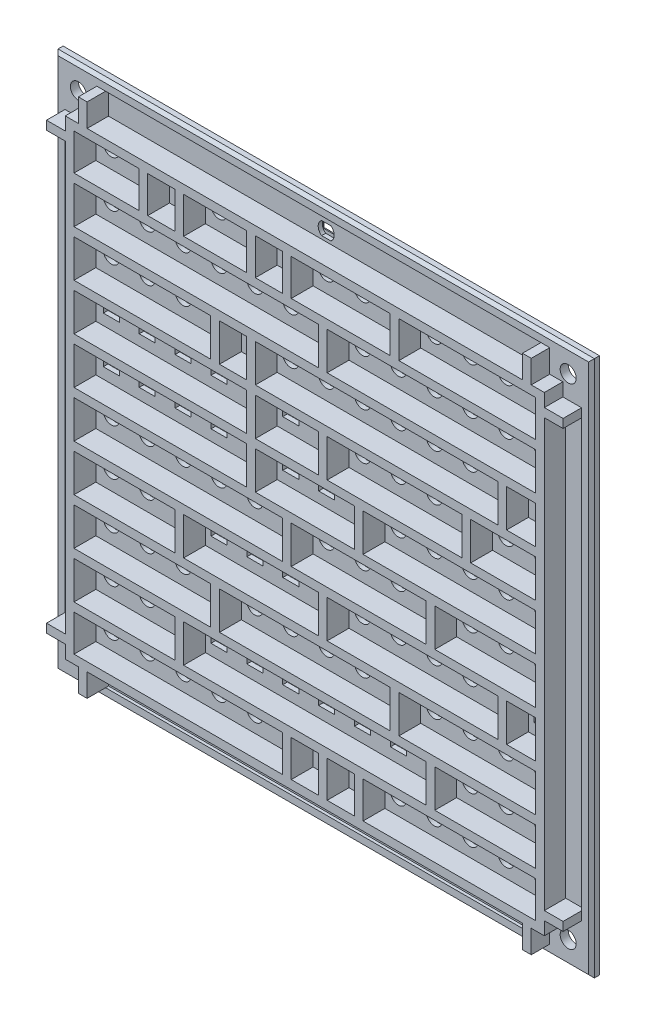
from build123d import *

# Parameters (mm, degrees)
SKETCH1_W                                    = 184.15
SKETCH1_H                                    = 184.15
PANEL_DEPTH                                  = 2.75
LED_HOLE_REACH                               = 132.243
SKETCH19_R                                   = 2.75
LED_HOLES_PATTERN_COUNT                      = 13
LED_HOLES_PATTERN_PITCH                      = 12.319
LED_HOLES_PATTERN_COUNT_DIR2                 = 10
LED_HOLES_PATTERN_PITCH_DIR2                 = 15.94
SKETCH2_R                                    = 2.75
SKETCH2_W                                    = 4.99243385
SKETCH2_H                                    = 2.307727076
CORNER_LEDS_LIGHT_SENSOR_CUT_DEPTH           = 131.242749318
LIGHT_SENSOR_HOLDER_DEPTH                    = 2.4
SKETCH6_W                                    = 164.47360298
SKETCH6_H                                    = 161.542860252
OUTER_LIGHT_WALLS_DEPTH                      = 6.35
SKETCH7_W                                    = 158.47360298
SKETCH7_H                                    = 155.542860252
OUTER_LIGHT_WALLS_CUT_DEPTH                  = 7.5
SKETCH8_W                                    = 158.47560298
SKETCH8_H                                    = 3
INNER_H_WALLS_DEPTH                          = 7.5
INNER_H_WALLS_PATTERN_COUNT                  = 9
INNER_H_WALLS_PATTERN_PITCH                  = 15.94
INNER_START                                  = -1.15
INNER_V_WALLS_1ST_LINE_DEPTH                 = 7.5
INNER_V_WALLS_PATTERN_1ST_LINE_COUNT         = 12
INNER_V_WALLS_PATTERN_1ST_LINE_PITCH         = 12.32
SKETCH13_W                                   = 3
SKETCH13_H                                   = 12.501430126
EXTRA_V_WALLS_REMOVAL_1ST_LINE_DEPTH         = 7.5
SKETCH14_W                                   = 3
SKETCH14_H                                   = 12.94
INNER_V_WALLS_DEPTH                          = 7.5
INNER_V_WALLS_PATTERN_COUNT                  = 12
INNER_V_WALLS_PATTERN_PITCH                  = 12.32
INNER_V_WALLS_PATTERN_COUNT_DIR2             = 9
INNER_V_WALLS_PATTERN_PITCH_DIR2             = 15.94
SKETCH15_W                                   = 3
SKETCH15_H                                   = 12.94
EXTRA_V_WALLS_REMOVAL_DEPTH                  = 7.5
SKETCH16_W                                   = 6.43819851
SKETCH16_H                                   = 3
SKETCH16_W_2                                 = 3
SKETCH16_H_2                                 = 7.903569874
CORNER_LED_LIGHT_BAFFLES_DEPTH               = 6.35
CORNER_LED_LIGHT_BAFFLES_MIRROR_2_COPY_1_W   = 6.43819851
CORNER_LED_LIGHT_BAFFLES_MIRROR_2_COPY_1_H   = 3
CORNER_LED_LIGHT_BAFFLES_MIRROR_2_COPY_1_W_2 = 3
CORNER_LED_LIGHT_BAFFLES_MIRROR_2_COPY_1_H_2 = 7.903569874
CORNER_LED_LIGHT_BAFFLES_MIRROR_2_CO_2_DEPTH = 6.35
LED_STRIP_SQUARE_HOLE_1ST_LINE_REACH         = 132.43
SKETCH20_W                                   = 5.5
SKETCH20_H                                   = 5.5
LED_STRIP_SQUARE_HOLE_REACH                  = 132.43
SKETCH22_W                                   = 5.5
SKETCH22_H                                   = 5.5
LED_STRIP_SQUARE_HOLES_PATTERN_COUNT         = 13
LED_STRIP_SQUARE_HOLES_PATTERN_PITCH         = 12.319
LED_STRIP_SQUARE_HOLES_PATTERN_COUNT_DIR2    = 6
LED_STRIP_SQUARE_HOLES_PATTERN_PITCH_DIR2    = 15.94
SKETCH27_W                                   = 149.47360298
SKETCH27_H                                   = 7.903569874
SKETCH27_W_2                                 = 6.43819851
SKETCH27_H_2                                 = 146.542860252
CUT_EXTRUDE15_DEPTH                          = 1
CHAMFER1_SIZE                                = 1


with BuildPart() as part:
    # Sketch1 → panel (new body)
    with BuildSketch(Plane.XY):
        Rectangle(SKETCH1_W, SKETCH1_H)
    extrude(amount=PANEL_DEPTH)

    # Sketch19 → LED hole (cut, up to next)
    with BuildSketch(Plane.XY.offset(2.75), mode=Mode.PRIVATE) as led_hole_sk1:
        with Locations((-73.915, 71.74)):
            Circle(SKETCH19_R)
    led_hole_tool1 = extrude(led_hole_sk1.sketch, amount=-LED_HOLE_REACH, mode=Mode.PRIVATE) & part.part
    led_hole = led_hole_tool1.solids().sort_by_distance((-73.915, 71.74, 2.75))[0]
    add(led_hole, mode=Mode.SUBTRACT)

    # LED holes pattern: LED hole 13 × 10, 32 skipped
    with Locations(*[(i * LED_HOLES_PATTERN_PITCH, -j * LED_HOLES_PATTERN_PITCH_DIR2, 0) for i in range(LED_HOLES_PATTERN_COUNT) for j in range(LED_HOLES_PATTERN_COUNT_DIR2) if (i, j) not in ((0, 0), (0, 3), (0, 4), (1, 3), (1, 4), (2, 0), (2, 3), (2, 4), (3, 3), (3, 4), (3, 6), (3, 8), (4, 2), (4, 3), (4, 4), (4, 6), (4, 8), (5, 0), (5, 3), (5, 4), (5, 6), (5, 8), (6, 3), (6, 4), (6, 6), (6, 8), (6, 9), (7, 4), (7, 8), (8, 8), (9, 8), (12, 2), (12, 6))]):
        add(led_hole, mode=Mode.SUBTRACT)

    # Sketch2 → corner LEDs _ light sensor cut (cut, through all)
    with BuildSketch(Plane.XY.offset(2.75)):
        with Locations((-84.075, 84.075)):
            Circle(SKETCH2_R)
        with Locations(Location((84.075, 84.075, 0), (0, 0, 180))):
            Circle(SKETCH2_R)
        with Locations((84.075, -84.075)):
            Circle(SKETCH2_R)
        with Locations(Location((-84.075, -84.075, 0), (0, 0, 180))):
            Circle(SKETCH2_R)
        with Locations((0, 84.075)):
            Rectangle(SKETCH2_W, SKETCH2_H)
    extrude(amount=-CORNER_LEDS_LIGHT_SENSOR_CUT_DEPTH, mode=Mode.SUBTRACT)

    # Sketch3 → light sensor holder (cut)
    with BuildSketch(Plane.XY.offset(2.75)):
        with BuildLine():
            Line((-1.58113883, 81.825), (1.58113883, 81.825))
            ThreePointArc((1.58113883, 81.825), (2.75, 84.075), (1.58113883, 86.325))
            Line((1.58113883, 86.325), (-1.58113883, 86.325))
            ThreePointArc((-1.58113883, 86.325), (-2.75, 84.075), (-1.58113883, 81.825))
        make_face()
    extrude(amount=-LIGHT_SENSOR_HOLDER_DEPTH, mode=Mode.SUBTRACT)

    # Sketch6 → outer light walls (add)
    with BuildSketch(Plane.XY.offset(2.75)):
        Rectangle(SKETCH6_W, SKETCH6_H)
    extrude(amount=OUTER_LIGHT_WALLS_DEPTH)

    # Sketch7 → outer light walls cut (cut)
    with BuildSketch(Plane.XY.offset(9.1)):
        Rectangle(SKETCH7_W, SKETCH7_H)
    extrude(amount=-OUTER_LIGHT_WALLS_CUT_DEPTH, mode=Mode.SUBTRACT)

    # Sketch8 → inner H walls (add)
    with BuildSketch(Plane.XY.offset(1.6)):
        with Locations((-0.001, 63.77)):
            Rectangle(SKETCH8_W, SKETCH8_H)
    inner_h_walls = extrude(amount=INNER_H_WALLS_DEPTH)

    # inner H walls pattern: inner H walls ×9
    with Locations(*[(0, -i * INNER_H_WALLS_PATTERN_PITCH, 0) for i in range(1, INNER_H_WALLS_PATTERN_COUNT)]):
        add(inner_h_walls)

    # Sketch12 → inner V walls _1st line (add)
    with BuildSketch(Plane.XY.offset(2.75).offset(INNER_START)):
        Polygon((-69.2555, 65.708569874), (-69.2555, 65.27), (-66.2555, 65.27), (-66.2555, 65.708569874), (-66.2555, 77.771430126), (-69.2555, 77.771430126), align=None)
    inner_v_walls_1st_line = extrude(amount=INNER_V_WALLS_1ST_LINE_DEPTH)

    # inner V walls pattern _1st line: inner V walls _1st line ×12, 6 skipped
    with Locations(*[(i * INNER_V_WALLS_PATTERN_1ST_LINE_PITCH, 0, 0) for i in range(1, INNER_V_WALLS_PATTERN_1ST_LINE_COUNT) if i not in (3, 6, 7, 9, 10, 11)]):
        add(inner_v_walls_1st_line)

    # Sketch13 → extra V walls removal _1st line (cut)
    with BuildSketch(Plane.XY.offset(9.1)):
        with Locations((-67.7555, 71.520715063)):
            Rectangle(SKETCH13_W, SKETCH13_H)
    extrude(amount=-EXTRA_V_WALLS_REMOVAL_1ST_LINE_DEPTH, mode=Mode.SUBTRACT)

    # Sketch14 → inner V walls (add)
    with BuildSketch(Plane.XY.offset(2.75).offset(INNER_START)):
        with Locations((-67.7555, 55.8)):
            Rectangle(SKETCH14_W, SKETCH14_H)
    inner_v_walls = extrude(amount=INNER_V_WALLS_DEPTH)

    # inner V walls pattern: inner V walls 12 × 9, 86 skipped
    with Locations(*[(i * INNER_V_WALLS_PATTERN_PITCH, -j * INNER_V_WALLS_PATTERN_PITCH_DIR2, 0) for i in range(INNER_V_WALLS_PATTERN_COUNT) for j in range(INNER_V_WALLS_PATTERN_COUNT_DIR2) if (i, j) not in ((0, 0), (0, 1), (0, 2), (0, 3), (0, 4), (0, 5), (0, 6), (0, 7), (0, 8), (1, 0), (1, 1), (1, 2), (1, 3), (1, 4), (1, 5), (1, 6), (1, 7), (1, 8), (2, 0), (2, 1), (2, 2), (2, 3), (2, 4), (2, 6), (2, 8), (3, 0), (3, 2), (3, 3), (3, 4), (3, 5), (3, 7), (3, 8), (4, 0), (4, 4), (4, 5), (4, 6), (4, 7), (4, 8), (5, 0), (5, 1), (5, 2), (5, 3), (5, 5), (5, 6), (5, 7), (6, 1), (6, 3), (6, 4), (6, 6), (6, 7), (7, 0), (7, 1), (7, 2), (7, 4), (7, 5), (7, 6), (7, 7), (8, 0), (8, 1), (8, 2), (8, 3), (8, 4), (8, 5), (8, 7), (8, 8), (9, 0), (9, 1), (9, 2), (9, 3), (9, 5), (9, 6), (9, 8), (10, 0), (10, 1), (10, 3), (10, 4), (10, 5), (10, 6), (10, 7), (10, 8), (11, 0), (11, 2), (11, 3), (11, 4), (11, 6), (11, 7), (11, 8))]):
        add(inner_v_walls)

    # Sketch15 → extra V walls removal (cut)
    with BuildSketch(Plane.XY.offset(9.1)):
        with Locations((-67.7555, 55.8)):
            Rectangle(SKETCH15_W, SKETCH15_H)
    extrude(amount=-EXTRA_V_WALLS_REMOVAL_DEPTH, mode=Mode.SUBTRACT)

    # Sketch16 → corner LED light baffles (add)
    with BuildSketch(Plane.XY.offset(2.75)):
        with Locations((-85.455900745, 74.771430126)):
            Rectangle(SKETCH16_W, SKETCH16_H)
        with Locations((-76.23680149, 84.723215063)):
            Rectangle(SKETCH16_W_2, SKETCH16_H_2)
    corner_led_light_baffles = extrude(amount=CORNER_LED_LIGHT_BAFFLES_DEPTH)

    # corner LED light baffles mirror: corner LED light baffles across plane
    add(corner_led_light_baffles.mirror(Plane(origin=(0, 0, 0), x_dir=(0, 0, 1), z_dir=(1, 0, 0))))

    # corner LED light baffles mirror 2: corner LED light baffles across plane
    add(corner_led_light_baffles.mirror(Plane.ZX))

    # corner LED light baffles mirror 2 copy 1 → corner LED light baffles mirror 2 co 2 (add)
    with BuildSketch(Plane(origin=(0, 0, 2.75), x_dir=(-1, 0, 0), z_dir=(0, 0, 1))):
        with Locations((-85.455900745, 74.771430126)):
            Rectangle(CORNER_LED_LIGHT_BAFFLES_MIRROR_2_COPY_1_W, CORNER_LED_LIGHT_BAFFLES_MIRROR_2_COPY_1_H)
        with Locations((-76.23680149, 84.723215063)):
            Rectangle(CORNER_LED_LIGHT_BAFFLES_MIRROR_2_COPY_1_W_2, CORNER_LED_LIGHT_BAFFLES_MIRROR_2_COPY_1_H_2)
    extrude(amount=CORNER_LED_LIGHT_BAFFLES_MIRROR_2_CO_2_DEPTH)

    # Sketch20 → LED strip square hole _1st line (cut, up to next)
    with BuildSketch(Plane.XY.offset(1.6), mode=Mode.PRIVATE) as led_strip_square_hole_1st_line_sk1:
        with Locations((-49.2755, 71.520715063)):
            Rectangle(SKETCH20_W, SKETCH20_H)
    led_strip_square_hole_1st_line_tool1 = extrude(led_strip_square_hole_1st_line_sk1.sketch, amount=-LED_STRIP_SQUARE_HOLE_1ST_LINE_REACH, mode=Mode.PRIVATE) & part.part
    add(led_strip_square_hole_1st_line_tool1.solids().sort_by_distance((-49.2755, 71.520715, 1.6))[0], mode=Mode.SUBTRACT)

    # Sketch22 → LED strip square hole (cut, up to next)
    with BuildSketch(Plane.XY.offset(1.6), mode=Mode.PRIVATE) as led_strip_square_hole_sk1:
        with Locations((-73.915, 23.92)):
            Rectangle(SKETCH22_W, SKETCH22_H)
    led_strip_square_hole_tool1 = extrude(led_strip_square_hole_sk1.sketch, amount=-LED_STRIP_SQUARE_HOLE_REACH, mode=Mode.PRIVATE) & part.part
    led_strip_square_hole = led_strip_square_hole_tool1.solids().sort_by_distance((-73.915, 23.92, 1.6))[0]
    add(led_strip_square_hole, mode=Mode.SUBTRACT)

    # LED strip square holes pattern: LED strip square hole 13 × 6, 51 skipped
    with Locations(*[(i * LED_STRIP_SQUARE_HOLES_PATTERN_PITCH, -j * LED_STRIP_SQUARE_HOLES_PATTERN_PITCH_DIR2, 0) for i in range(LED_STRIP_SQUARE_HOLES_PATTERN_COUNT) for j in range(LED_STRIP_SQUARE_HOLES_PATTERN_COUNT_DIR2) if (i, j) not in ((0, 0), (0, 2), (0, 3), (0, 4), (0, 5), (1, 2), (1, 3), (1, 4), (1, 5), (2, 2), (2, 3), (2, 4), (2, 5), (3, 2), (3, 4), (4, 2), (4, 4), (5, 2), (5, 4), (6, 2), (6, 4), (7, 0), (7, 2), (7, 3), (7, 4), (8, 0), (8, 1), (8, 2), (8, 3), (8, 4), (9, 0), (9, 1), (9, 2), (9, 3), (9, 4), (10, 0), (10, 1), (10, 2), (10, 3), (10, 4), (10, 5), (11, 0), (11, 1), (11, 2), (11, 3), (11, 4), (11, 5), (12, 0), (12, 1), (12, 2), (12, 4), (12, 5))]):
        add(led_strip_square_hole, mode=Mode.SUBTRACT)

    # Sketch27 → Cut-Extrude15 (cut)
    with BuildSketch(Plane.XY.offset(2.75)):
        with Locations((0, 84.723215063)):
            Rectangle(SKETCH27_W, SKETCH27_H)
        with Locations((-85.455900745, 0)):
            Rectangle(SKETCH27_W_2, SKETCH27_H_2)
        with Locations((0, -84.723215063)):
            Rectangle(SKETCH27_W, SKETCH27_H)
        with Locations((85.455900745, 0)):
            Rectangle(SKETCH27_W_2, SKETCH27_H_2)
    extrude(amount=-CUT_EXTRUDE15_DEPTH, mode=Mode.SUBTRACT)

    # Chamfer1
    chamfer1_edges = [part.edges().sort_by_distance(p)[0] for p in [
        (-92.075, 0, 2.75),
        (0, -92.075, 2.75),
        (92.075, 0, 2.75),
        (0, 92.075, 2.75),
    ]]
    chamfer(chamfer1_edges, length=CHAMFER1_SIZE)


solid = part.part
